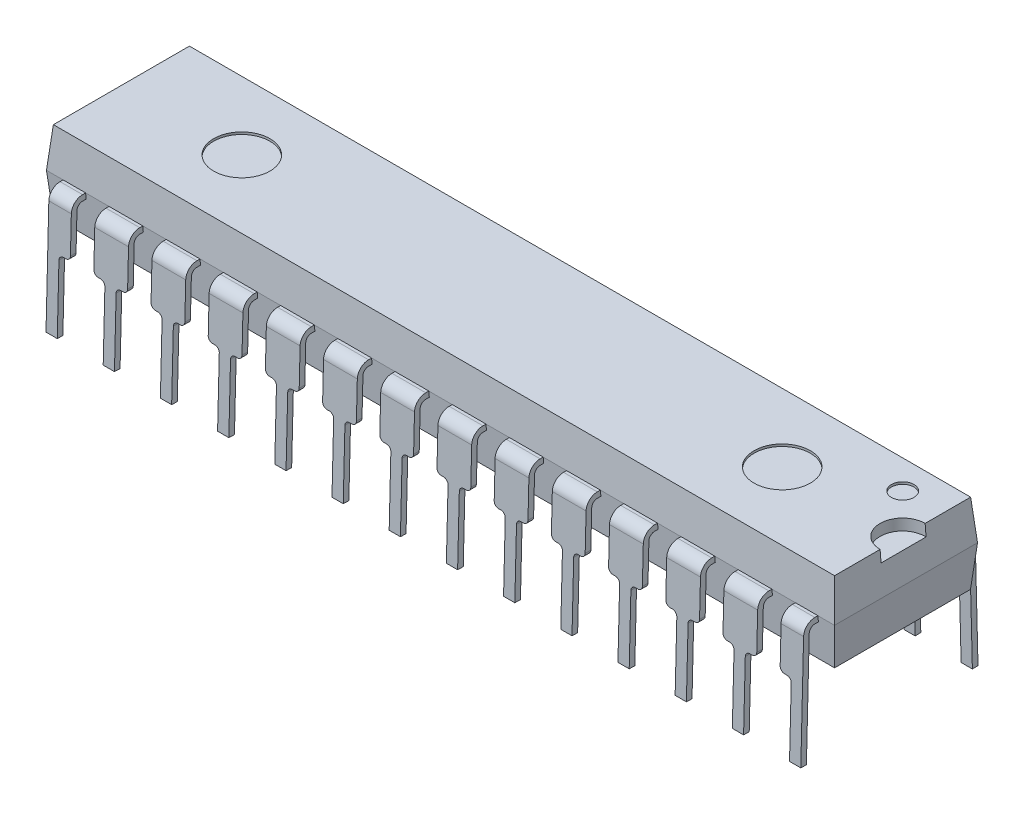
from build123d import *

# Parameters (mm, degrees)
EXTRUDE_THIN1_DEPTH     = 16.76
CUT_EXTRUDE6_DEPTH      = 18.508115293
LPATTERN1_COUNT         = 13
LPATTERN1_PITCH         = 2.54
BOSS_EXTRUDE1_DEPTH     = 17.5
CUT_EXTRUDE2_DEPTH      = 19.388494365
CUT_EXTRUDE2_DEPTH_BACK = 19.388494365
SKETCH5_R               = 1
CUT_EXTRUDE3_DEPTH      = 0.5
SKETCH6_R               = 1.25
SKETCH6_R_2             = 0.5
CUT_EXTRUDE4_DEPTH      = 0.1
INDENT1_START           = 2.045
INDENT1_OUTLINE_W       = 1
INDENT1_OUTLINE_H       = 10
INDENT1_OUTLINE_W_2     = 1.5
INDENT1_DEPTH           = 0.25


# Read off the part's stored shape, not the designer's step: Indent1
with BuildPart() as part:
    # Sketch1 → Extrude-Thin1 (new, symmetric)
    with BuildSketch(Plane(origin=(0, 0, 0), x_dir=(0, 0, -1), z_dir=(1, 0, 0))):
        with BuildLine():
            Line((-3.935, -3.18), (-3.81, 1.807527326))
            ThreePointArc((-3.81, 1.807527326), (-3.659253175, 2.152955069), (-3.310156959, 2.295))
            Line((-3.310156959, 2.295), (3.310156959, 2.295))
            ThreePointArc((3.310156959, 2.295), (3.659253175, 2.152955069), (3.81, 1.807527326))
            Line((3.81, 1.807527326), (3.935, -3.18))
            Line((3.935, -3.18), (3.685078479, -3.186263663))
            Line((3.685078479, -3.186263663), (3.560078479, 1.801263663))
            ThreePointArc((3.560078479, 1.801263663), (3.484705067, 1.973977535), (3.310156959, 2.045))
            Line((3.310156959, 2.045), (-3.310156959, 2.045))
            ThreePointArc((-3.310156959, 2.045), (-3.484705067, 1.973977535), (-3.560078479, 1.801263663))
            Line((-3.560078479, 1.801263663), (-3.685078479, -3.186263663))
            Line((-3.685078479, -3.186263663), (-3.935, -3.18))
        make_face()
    extrude(amount=EXTRUDE_THIN1_DEPTH, both=True)

    # Sketch8 → Cut-Extrude6 (cut, symmetric)
    with BuildSketch(Plane.XY):
        with BuildLine():
            Line((-15.76, 2.295), (-14.72, 2.295))
            Line((-14.72, 2.295), (-14.72, 0.2))
            ThreePointArc((-14.72, 0.2), (-14.661421356, 0.058578644), (-14.52, 0))
            Line((-14.52, 0), (-14.42, 0))
            ThreePointArc((-14.42, 0), (-14.278578644, -0.058578644), (-14.22, -0.2))
            Line((-14.22, -0.2), (-14.22, -3.5))
            Line((-14.22, -3.5), (-16.26, -3.5))
            Line((-16.26, -3.5), (-16.26, -0.2))
            ThreePointArc((-16.26, -0.2), (-16.201421356, -0.058578644), (-16.06, 0))
            Line((-16.06, 0), (-15.96, 0))
            ThreePointArc((-15.96, 0), (-15.818578644, 0.058578644), (-15.76, 0.2))
            Line((-15.76, 0.2), (-15.76, 2.295))
        make_face()
    cut_extrude6 = extrude(amount=CUT_EXTRUDE6_DEPTH, both=True, mode=Mode.SUBTRACT)


with BuildPart() as cut_extrude6_piece_1:
    # of the separate pieces the step leaves, piece 1, a body of its own (cut_extrude6_pieces)
    add(part.part.solids().sort_by_distance((-14.72, 1.801263663, 3.560078479))[0])

    # LPattern1: Cut-Extrude6 ×13
    with Locations(*[(i * LPATTERN1_PITCH, 0, 0) for i in range(1, LPATTERN1_COUNT)]):
        add(cut_extrude6, mode=Mode.SUBTRACT)


with BuildPart() as cut_extrude6_piece_2:
    # of the separate pieces the step leaves, piece 2, a body of its own (cut_extrude6_pieces)
    add(part.part.solids().sort_by_distance((-16.76, 1.801263663, 3.560078479))[0])


with BuildPart() as body_3:
    # Sketch3 → Boss-Extrude1 (new, symmetric)
    with BuildSketch(Plane(origin=(0, 0, 0), x_dir=(0, 0, -1), z_dir=(1, 0, 0))):
        Polygon((-3.017957849, 0.5), (3.017957849, 0.5), (3.175, 2.295), (3.021457396, 4.05), (-3.021457396, 4.05), (-3.175, 2.295), align=None)
    extrude(amount=BOSS_EXTRUDE1_DEPTH, both=True)

    # Sketch4 → Cut-Extrude2 (cut, two sides: drawn at the far end of the back side and taken through both)
    with BuildSketch(Plane.XY.offset(-CUT_EXTRUDE2_DEPTH_BACK)):
        Polygon((-17.5, 2.295), (-17.346457396, 4.05), (-17.5, 4.05), align=None)
        Polygon((17.346457396, 4.05), (17.5, 4.05), (17.5, 2.295), align=None)
        Polygon((-17.5, 2.295), (-17.5, 0.5), (-17.342957849, 0.5), align=None)
        Polygon((17.5, 2.295), (17.5, 0.5), (17.342957849, 0.5), align=None)
    extrude(amount=CUT_EXTRUDE2_DEPTH + CUT_EXTRUDE2_DEPTH_BACK, mode=Mode.SUBTRACT)

    # Sketch5 → Cut-Extrude3 (cut)
    with BuildSketch(Plane(origin=(0, 4.05, 0), x_dir=(1, 0, 0), z_dir=(0, 1, 0))):
        with Locations((17.346457396, 0)):
            Circle(SKETCH5_R)
    extrude(amount=-CUT_EXTRUDE3_DEPTH, mode=Mode.SUBTRACT)

    # Sketch6 → Cut-Extrude4 (cut)
    with BuildSketch(Plane(origin=(0, 4.05, 0), x_dir=(1, 0, 0), z_dir=(0, 1, 0))):
        with Locations(Location((-12, 0, 0), (0, 0, 270))):
            Circle(SKETCH6_R)
        with Locations(Location((12, 0, 0), (0, 0, 270))):
            Circle(SKETCH6_R)
        with Locations(Location((15.6, 1.75, 0), (0, 0, 270))):
            Circle(SKETCH6_R_2)
    extrude(amount=-CUT_EXTRUDE4_DEPTH, mode=Mode.SUBTRACT)

    # Indent1 outline → Indent1 (cut)
    with BuildSketch(Plane(origin=(0, 0, 0), x_dir=(1, 0, 0), z_dir=(0, 1, 0)).offset(INDENT1_START)):
        with Locations((16.26, 0)):
            Rectangle(INDENT1_OUTLINE_W, INDENT1_OUTLINE_H)
        with Locations((13.97, 0)):
            Rectangle(INDENT1_OUTLINE_W_2, INDENT1_OUTLINE_H)
        with Locations((11.43, 0)):
            Rectangle(INDENT1_OUTLINE_W_2, INDENT1_OUTLINE_H)
        with Locations((8.89, 0)):
            Rectangle(INDENT1_OUTLINE_W_2, INDENT1_OUTLINE_H)
        with Locations((6.35, 0)):
            Rectangle(INDENT1_OUTLINE_W_2, INDENT1_OUTLINE_H)
        with Locations((3.81, 0)):
            Rectangle(INDENT1_OUTLINE_W_2, INDENT1_OUTLINE_H)
        with Locations((1.27, 0)):
            Rectangle(INDENT1_OUTLINE_W_2, INDENT1_OUTLINE_H)
        with Locations((-1.27, 0)):
            Rectangle(INDENT1_OUTLINE_W_2, INDENT1_OUTLINE_H)
        with Locations((-3.81, 0)):
            Rectangle(INDENT1_OUTLINE_W_2, INDENT1_OUTLINE_H)
        with Locations((-6.35, 0)):
            Rectangle(INDENT1_OUTLINE_W_2, INDENT1_OUTLINE_H)
        with Locations((-8.89, 0)):
            Rectangle(INDENT1_OUTLINE_W_2, INDENT1_OUTLINE_H)
        with Locations((-11.43, 0)):
            Rectangle(INDENT1_OUTLINE_W_2, INDENT1_OUTLINE_H)
        with Locations((-13.97, 0)):
            Rectangle(INDENT1_OUTLINE_W_2, INDENT1_OUTLINE_H)
        with Locations((-16.26, 0)):
            Rectangle(INDENT1_OUTLINE_W, INDENT1_OUTLINE_H)
    extrude(amount=INDENT1_DEPTH, mode=Mode.SUBTRACT)


solid = Compound([cut_extrude6_piece_1.part, cut_extrude6_piece_2.part, body_3.part])
